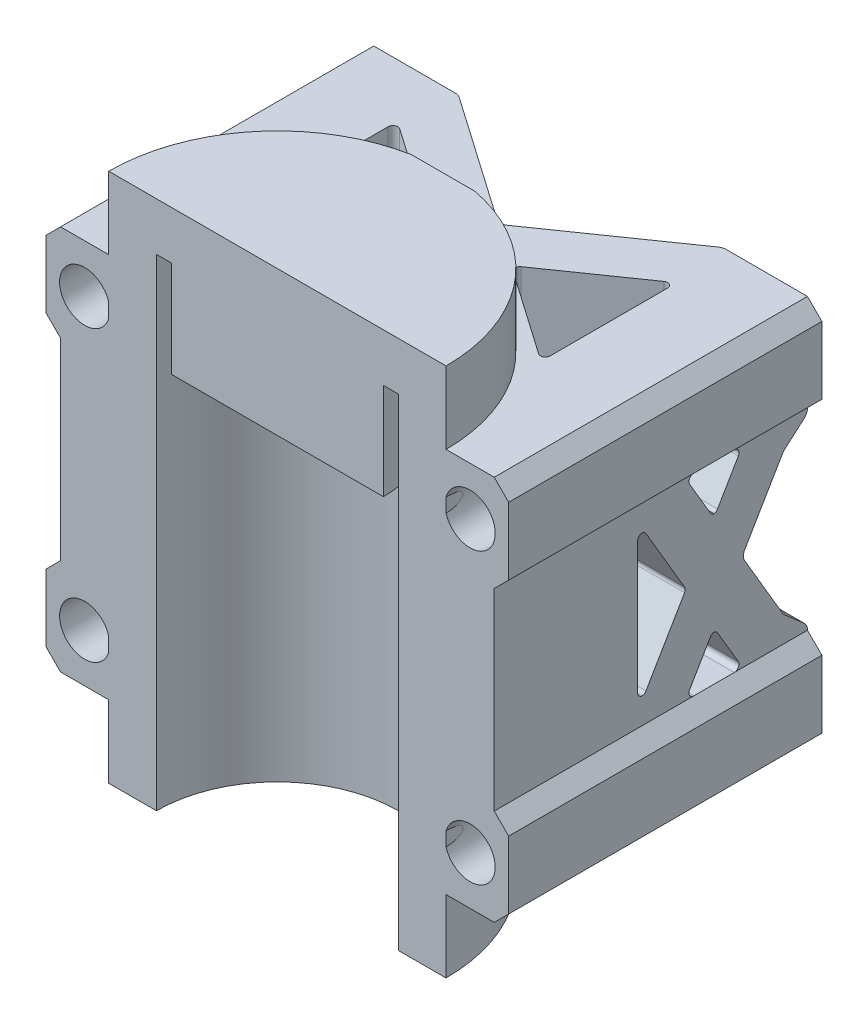
from build123d import *

# Parameters (mm, degrees)
BOSS_EXTRUDE1_DEPTH = 55
SKETCH4_R           = 2.6
BOSS_EXTRUDE2_DEPTH = 30
BOSS_EXTRUDE3_REACH = 55.686
SKETCH6_W           = 8
SKETCH6_H           = 30
BOSS_EXTRUDE4_REACH = 55.686
SKETCH7_W           = 8
SKETCH7_H           = 30
SKETCH8_W           = 20.202041029
SKETCH8_H           = 8
BOSS_EXTRUDE5_DEPTH = 29
SKETCH9_R           = 12.45
CUT_EXTRUDE1_DEPTH  = 100
CUT_EXTRUDE2_DEPTH  = 50
CUT_EXTRUDE15_DEPTH = 10
BOSS_EXTRUDE6_DEPTH = 2.5
CUT_EXTRUDE16_DEPTH = 80.01502149
CUT_EXTRUDE17_DEPTH = 63.357315313
FILLET1_R           = 1
FILLET4_R           = 0.5
SKETCH16_R          = 2.6
CUT_EXTRUDE18_DEPTH = 68.089006395
BOSS_EXTRUDE7_START = -5
BOSS_EXTRUDE7_DEPTH = 5
BOSS_EXTRUDE8_START = -15
BOSS_EXTRUDE8_DEPTH = 15
CUT_EXTRUDE21_START = 51
SKETCH18_R          = 12.55
SKETCH18_R_2        = 11
CUT_EXTRUDE21_DEPTH = 51


with BuildPart() as part:
    # Sketch1 → Boss-Extrude1 (new body)
    with BuildSketch(Plane(origin=(0, 0, 0), x_dir=(1, 0, 0), z_dir=(0, 1, 0))):
        with BuildLine():
            Line((-17.5, 0), (-12.55, 0))
            ThreePointArc((-12.55, 0), (-8.874190104, 8.874190104), (0, 12.55))
            ThreePointArc((0, 12.55), (8.874190104, 8.874190104), (12.55, 0))
            Line((12.55, 0), (17.5, 0))
            ThreePointArc((17.5, 0), (13.480591053, 11.1590172), (3.268724015, 17.192016848))
            Line((3.268724015, 17.192016848), (-0.344865062, 17.192016848))
            Line((-0.344865062, 17.192016848), (-3.268724015, 17.192016848))
            ThreePointArc((-3.268724015, 17.192016848), (-13.480591053, 11.1590172), (-17.5, 0))
        make_face()
    extrude(amount=BOSS_EXTRUDE1_DEPTH)

    # Sketch4 → Boss-Extrude2 (add)
    # profile 1 of 4: a face of its own
    with BuildSketch(Plane.XY):
        Polygon((-23.998641066, 16.001358934), (-22.5, 17.5), (-14.5, 17.5), (-14.5, 12.5), (-14.5, 7.5), (-22.5, 7.5), (-23.998641066, 8.998641066), align=None)
        with Locations((-19.998641066, 12.5)):
            Circle(SKETCH4_R, mode=Mode.SUBTRACT)
    # profile 2 of 4: a face of its own
    with BuildSketch(Plane.XY):
        Polygon((14.5, 7.5), (14.5, 12.5), (14.5, 17.5), (22.5, 17.5), (23.998641066, 16.001358934), (23.998641066, 8.998641066), (22.5, 7.5), align=None)
        with Locations((19.998641066, 12.5)):
            Circle(SKETCH4_R, mode=Mode.SUBTRACT)
    # profile 3 of 4: a face of its own
    with BuildSketch(Plane.XY):
        Polygon((14.5, 37.5), (14.5, 42.5), (14.5, 47.5), (22.5, 47.5), (23.998641066, 46.001358934), (23.998641066, 38.998641066), (22.5, 37.5), align=None)
        with Locations((19.998641066, 42.5)):
            Circle(SKETCH4_R, mode=Mode.SUBTRACT)
    # profile 4 of 4: a face of its own
    with BuildSketch(Plane.XY):
        Polygon((-22.5, 47.5), (-14.5, 47.5), (-14.5, 42.5), (-14.5, 37.5), (-22.5, 37.5), (-23.998641066, 38.998641066), (-23.998641066, 46.001358934), align=None)
        with Locations((-19.998641066, 42.5)):
            Circle(SKETCH4_R, mode=Mode.SUBTRACT)
    extrude(amount=-BOSS_EXTRUDE2_DEPTH)

    # Sketch6 → Boss-Extrude3 (add, up to next)
    with BuildSketch(Plane.XZ.offset(-37.5), mode=Mode.PRIVATE) as boss_extrude3_sk1:
        with Locations((-18.5, -15)):
            Rectangle(SKETCH6_W, SKETCH6_H)
    boss_extrude3_tool1 = extrude(boss_extrude3_sk1.sketch, amount=BOSS_EXTRUDE3_REACH, mode=Mode.PRIVATE) - part.part
    add(boss_extrude3_tool1.solids().sort_by_distance((-18.5, 37.5, -15))[0])

    # Sketch7 → Boss-Extrude4 (add, up to next)
    with BuildSketch(Plane.XZ.offset(-37.5), mode=Mode.PRIVATE) as boss_extrude4_sk1:
        with Locations((18.5, -15)):
            Rectangle(SKETCH7_W, SKETCH7_H)
    boss_extrude4_tool1 = extrude(boss_extrude4_sk1.sketch, amount=BOSS_EXTRUDE4_REACH, mode=Mode.PRIVATE) - part.part
    add(boss_extrude4_tool1.solids().sort_by_distance((18.5, 37.5, -15))[0])

    # Sketch8 → Boss-Extrude5 (add)
    with BuildSketch(Plane(origin=(-14.5, 0, 0), x_dir=(0, 0, -1), z_dir=(1, 0, 0))):
        with Locations((19.898979485, 11.5)):
            Rectangle(SKETCH8_W, SKETCH8_H)
        with Locations((19.898979485, 43.5)):
            Rectangle(SKETCH8_W, SKETCH8_H)
    extrude(amount=BOSS_EXTRUDE5_DEPTH)

    # Sketch9 → Cut-Extrude1 (cut)
    with BuildSketch(Plane.XZ.offset(-7.5)):
        Circle(SKETCH9_R)
    extrude(amount=-CUT_EXTRUDE1_DEPTH, mode=Mode.SUBTRACT)

    # Sketch10 → Cut-Extrude2 (cut, symmetric)
    with BuildSketch(Plane.XZ.offset(-39.5)):
        Polygon((14.5, -12.84476299), (4.37368266, -19.898979486), (14.5, -26.953195981), align=None)
        Polygon((10.12631734, -30), (0, -22.945783504), (-10.12631734, -30), align=None)
        Polygon((-14.5, -26.953195981), (-4.37368266, -19.898979486), (-14.5, -12.84476299), align=None)
    extrude(amount=CUT_EXTRUDE2_DEPTH, both=True, mode=Mode.SUBTRACT)

    # Sketch11 → Cut-Extrude15 (cut)
    with BuildSketch(Plane(origin=(-14.5, 0, 0), x_dir=(0, 0, -1), z_dir=(1, 0, 0))):
        Polygon((29.02361167, 33.15567867), (25.698913189, 27.5), (29.02361167, 21.84432133), (30, 20.184821184), (30, 22.184821184), (30, 32.816622868), (30, 34.816622868), (29.821873982, 34.513610872), align=None)
        Polygon((22.573529128, 32.816622868), (23.024363547, 32.816622868), (24.200066296, 34.816622868), (21.397826379, 34.816622868), align=None)
        Polygon((21.397826379, 34.816622868), (24.200066296, 34.816622868), (25.777493232, 37.5), (22.281875838, 37.5), (19.820399443, 37.5), align=None)
        Polygon((15.598741563, 20.184821184), (19.898979486, 27.5), (15.597892675, 34.816622868), (14.875672645, 34.816622868), (14.875672645, 20.184821184), align=None)
        Polygon((22.574378016, 22.184821184), (21.398675266, 20.184821184), (24.199217408, 20.184821184), (23.023514659, 22.184821184), align=None)
        Polygon((24.199217408, 20.184821184), (21.398675266, 20.184821184), (19.820399443, 17.5), (22.402804222, 17.5), (25.777493232, 17.5), align=None)
    cut_extrude15 = extrude(amount=-CUT_EXTRUDE15_DEPTH, mode=Mode.SUBTRACT)

    # Mirror1: Cut-Extrude15 across plane
    add(cut_extrude15.mirror(Plane(origin=(0, 0, 0), x_dir=(0, 0, 1), z_dir=(1, 0, 0))), mode=Mode.SUBTRACT)

    # Sketch12 → Boss-Extrude6 (add)
    with BuildSketch(Plane(origin=(0, 0, -30), x_dir=(-1, 0, 0), z_dir=(0, 0, -1))):
        Polygon((10.12631734, 15.5), (14.5, 15.5), (14.5, 20.184821184), (22.5, 20.184821184), (22.5, 17.5), (23.998641066, 16.001358934), (23.998641066, 8.998641066), (22.5, 7.5), (10.12631734, 7.5), align=None)
        Polygon((-22.5, 17.5), (-22.5, 20.184821184), (-14.5, 20.184821184), (-14.5, 15.5), (-10.12631734, 15.5), (-10.12631734, 7.5), (-22.5, 7.5), (-23.998641066, 8.998641066), (-23.998641066, 16.001358934), align=None)
        Polygon((-22.5, 37.5), (-23.998641066, 38.998641066), (-23.998641066, 46.001358934), (-22.5, 47.5), (-10.12631734, 47.5), (-10.12631734, 39.5), (-14.5, 39.5), (-14.5, 34.816622868), (-22.5, 34.816622868), align=None)
        Polygon((10.12631734, 47.5), (10.12631734, 39.5), (14.5, 39.5), (14.5, 34.816622868), (22.5, 34.816622868), (22.5, 37.5), (23.998641066, 38.998641066), (23.998641066, 46.001358934), (22.5, 47.5), align=None)
    extrude(amount=BOSS_EXTRUDE6_DEPTH)

    # Sketch13 → Cut-Extrude16 (cut, through all)
    with BuildSketch(Plane.ZY.offset(22.5)):
        Polygon((-32.5, 20.184821184), (-32.5, 18), (-30, 20.184821184), align=None)
        Polygon((-30, 34.816622868), (-32.5, 37), (-32.5, 34.816622868), align=None)
    extrude(amount=-CUT_EXTRUDE16_DEPTH, mode=Mode.SUBTRACT)

    # Sketch14 → Cut-Extrude17 (cut, through all)
    with BuildSketch(Plane(origin=(0, 47.5, 0), x_dir=(1, 0, 0), z_dir=(0, 1, 0))):
        Polygon((-10.12631734, 30), (-13.715063641, 32.5), (-10.12631734, 32.5), align=None)
        Polygon((10.12631734, 30), (13.715063641, 32.5), (10.12631734, 32.5), align=None)
    extrude(amount=-CUT_EXTRUDE17_DEPTH, mode=Mode.SUBTRACT)

    # Fillet1
    fillet1_edges = [part.edges().sort_by_distance(p)[0] for p in [
        (0, 43.5, -22.945783504),
        (0, 11.5, -22.945783504),
        (-18.5, 27.5, -25.698913189),
        (-18.5, 34.816622868, -30),
        (-18.5, 20.184821184, -30),
        (18.5, 27.5, -25.698913189),
        (18.5, 20.184821184, -30),
        (18.5, 34.816622868, -30),
        (18.5, 18, -32.5),
        (-18.5, 18, -32.5),
        (18.5, 37, -32.5),
        (-18.5, 37, -32.5),
        (-13.715063641, 11.5, -32.5),
        (-13.715063641, 43.5, -32.5),
        (13.715063641, 11.5, -32.5),
        (13.715063641, 43.5, -32.5),
    ]]
    fillet(fillet1_edges, radius=FILLET1_R)

    # Fillet4
    # the kernel refuses this fillet: 0.5 mm, written as the material it adds along each edge
    with BuildSketch(Plane(origin=(-14.5, 39.5, -12.84476299), x_dir=(0, 0, -1), z_dir=(0, 1, 0)), Plane(origin=(-14.5, 7.5, -26.953195981), x_dir=(0.8205319360133092, 2.8568127323077983e-15, 0.5716006840288512), z_dir=(0, 1, 0)), Plane(origin=(14.5, 47.5, -12.84476299), x_dir=(0, 0, -1), z_dir=(0, -1, 0)), Plane(origin=(14.5, 15.5, -12.84476299), x_dir=(0, 0, -1), z_dir=(0, -1, 0)), Plane(origin=(14.5, 39.5, -26.953195981), x_dir=(0, 0, 1), z_dir=(0, 1, 0)), Plane(origin=(14.5, 7.5, -26.953195981), x_dir=(0, 0, 1), z_dir=(0, 1, 0))) as fillet4_piece_1:
        with BuildLine():
            CenterArc((FILLET4_R * 1.91534371187, -FILLET4_R), FILLET4_R, 90, 124.861921912)
            Line((FILLET4_R * 1.09481177585, -FILLET4_R * 1.57160068403), (0, 0))
            Line((0, 0), (FILLET4_R * 1.91534371187, 0))
        make_face()
    extrude(amount=8)
    with BuildSketch(Plane(origin=(-14.5, 7.5, -12.84476299), x_dir=(0.8205319360133058, 2.856812732307786e-15, -0.5716006840288562), z_dir=(0, 1, 0)), Plane(origin=(-14.5, 39.5, -26.953195981), x_dir=(0, 0, 1), z_dir=(0, 1, 0))) as fillet4_piece_2:
        with BuildLine():
            CenterArc((FILLET4_R * 1.91534371187, FILLET4_R), FILLET4_R, 145.138078088, 124.861921912)
            Line((FILLET4_R * 1.09481177585, FILLET4_R * 1.57160068403), (0, 0))
            Line((0, 0), (FILLET4_R * 1.91534371187, 0))
        make_face()
    extrude(amount=8)
    with BuildSketch(Plane(origin=(-4.37368266, 47.5, -19.898979486), x_dir=(-0.8205319360133027, -2.849524944725357e-15, 0.5716006840288604), z_dir=(0, -1, 0)), Plane(origin=(4.37368266, 7.5, -19.898979486), x_dir=(0.8205319360133051, 2.849524944725366e-15, 0.5716006840288572), z_dir=(0, 1, 0))) as fillet4_piece_3:
        with BuildLine():
            CenterArc((FILLET4_R * 1.4354985201, FILLET4_R), FILLET4_R, 159.723843824, 110.276156176)
            Line((FILLET4_R * 0.497465288318, FILLET4_R * 1.34654531604), (0, 0))
            Line((0, 0), (FILLET4_R * 1.4354985201, 0))
        make_face()
    extrude(amount=8)
    with BuildSketch(Plane(origin=(-4.37368266, 15.5, -19.898979486), x_dir=(-0.8205319360133059, -2.8495249447253684e-15, -0.571600684028856), z_dir=(0, -1, 0)), Plane(origin=(4.37368266, 39.5, -19.898979486), x_dir=(0.8205319360132926, 2.8495249447253227e-15, -0.5716006840288751), z_dir=(0, 1, 0))) as fillet4_piece_4:
        with BuildLine():
            CenterArc((FILLET4_R * 1.4354985201, -FILLET4_R), FILLET4_R, 90, 110.276156176)
            Line((FILLET4_R * 0.497465288318, -FILLET4_R * 1.34654531604), (0, 0))
            Line((0, 0), (FILLET4_R * 1.4354985201, 0))
        make_face()
    extrude(amount=8)
    with BuildSketch(Plane(origin=(-14.5, 34.816622868, -15.597892675), x_dir=(0, 0, 1), z_dir=(-1, 0, 0)), Plane(origin=(14.5, 34.816622868, -15.597892675), x_dir=(-2.9909367323885665e-15, -0.8620788194223284, -0.5067742190595379), z_dir=(1, 0, 0)), Plane(origin=(14.5, 32.816622868, -23.024363547), x_dir=(0, 0, 1), z_dir=(1, 0, 0)), Plane(origin=(14.5, 22.184821184, -22.574378016), x_dir=(0, 0, -1), z_dir=(1, 0, 0))) as fillet4_piece_5:
        with BuildLine():
            CenterArc((FILLET4_R * 0.572135366081, -FILLET4_R), FILLET4_R, 90, 59.550800041)
            Line((-FILLET4_R * 0.289943453342, -FILLET4_R * 0.49322578094), (0, 0))
            Line((0, 0), (FILLET4_R * 0.572135366081, 0))
        make_face()
    extrude(amount=8)
    with BuildSketch(Plane(origin=(-14.5, 27.5, -19.898979486), x_dir=(2.990936732388565e-15, -0.862078819422328, 0.5067742190595386), z_dir=(-1, 0, 0))) as fillet4_piece_6:
        with BuildLine():
            CenterArc((FILLET4_R * 0.587851374656, FILLET4_R), FILLET4_R, 209.101600081, 60.898399919)
            Line((-FILLET4_R * 0.285907266305, FILLET4_R * 0.513640218207), (0, 0))
            Line((0, 0), (FILLET4_R * 0.587851374656, 0))
        make_face()
    extrude(amount=8)
    with BuildSketch(Plane(origin=(-14.5, 20.184821184, -15.598741563), x_dir=(0, 0, 1), z_dir=(-1, 0, 0)), Plane(origin=(-14.5, 32.816622868, -23.024363547), x_dir=(0, 0, 1), z_dir=(-1, 0, 0)), Plane(origin=(-14.5, 32.816622868, -22.573529128), x_dir=(-2.990936732388557e-15, 0.8620788194223257, 0.5067742190595426), z_dir=(-1, 0, 0)), Plane(origin=(-14.5, 22.184821184, -23.023514659), x_dir=(2.990936732388576e-15, -0.8620788194223311, -0.5067742190595332), z_dir=(-1, 0, 0)), Plane(origin=(-14.5, 22.184821184, -22.574378016), x_dir=(0, 0, -1), z_dir=(-1, 0, 0)), Plane(origin=(14.5, 20.184821184, -15.598741563), x_dir=(2.990936732388546e-15, 0.8620788194223225, -0.5067742190595479), z_dir=(1, 0, 0)), Plane(origin=(14.5, 32.816622868, -22.573529128), x_dir=(0, 0, -1), z_dir=(1, 0, 0)), Plane(origin=(14.5, 22.184821184, -23.023514659), x_dir=(0, 0, 1), z_dir=(1, 0, 0))) as fillet4_piece_7:
        with BuildLine():
            CenterArc((FILLET4_R * 0.572135366081, FILLET4_R), FILLET4_R, 210.449199959, 59.550800041)
            Line((-FILLET4_R * 0.289943453342, FILLET4_R * 0.49322578094), (0, 0))
            Line((0, 0), (FILLET4_R * 0.572135366081, 0))
        make_face()
    extrude(amount=8)
    with BuildSketch(Plane(origin=(-14.5, 20.184821184, -14.875672645), x_dir=(0, 0, -1), z_dir=(-1, 0, 0)), Plane(origin=(-14.5, 34.816622868, -14.875672645), x_dir=(0, -1, 0), z_dir=(-1, 0, 0))) as fillet4_piece_8:
        with BuildLine():
            CenterArc((FILLET4_R, -FILLET4_R), FILLET4_R, 90, 90)
            Line((0, -FILLET4_R), (0, 0))
            Line((0, 0), (FILLET4_R, 0))
        make_face()
    extrude(amount=8)
    with BuildSketch(Plane(origin=(-14.5, 37.5, -19.820399443), x_dir=(2.9909367323885563e-15, -0.8620788194223254, -0.5067742190595429), z_dir=(-1, 0, 0))) as fillet4_piece_9_section:
        with BuildLine():
            CenterArc((FILLET4_R * 1.74783811539, -FILLET4_R), FILLET4_R, 90, 120.449199959)
            Line((FILLET4_R * 0.885759295971, -FILLET4_R * 1.50677421906), (0, 0))
            Line((0, 0), (FILLET4_R * 1.74783811539, 0))
        make_face()
    fillet4_piece_9 = extrude(amount=8, mode=Mode.PRIVATE)
    fillet4_piece_9 = split(fillet4_piece_9, bisect_by=Plane(origin=(-20.363529136, 35.363529136, -20.144307431), z_dir=(0.7071067811865483, 0.7071067811865467, 0)), keep=Keep.TOP, mode=Mode.PRIVATE)
    add(fillet4_piece_9)
    with BuildSketch(Plane(origin=(-14.5, 37.5, -19.820399443), x_dir=(2.9909367323885563e-15, -0.8620788194223254, -0.5067742190595429), z_dir=(-1, 0, 0))) as fillet4_piece_10_section:
        with BuildLine():
            CenterArc((FILLET4_R * 1.74783811539, -FILLET4_R), FILLET4_R, 90, 120.449199959)
            Line((FILLET4_R * 0.885759295971, -FILLET4_R * 1.50677421906), (0, 0))
            Line((0, 0), (FILLET4_R * 1.74783811539, 0))
        make_face()
    fillet4_piece_10 = extrude(amount=8, mode=Mode.PRIVATE)
    fillet4_piece_10 = split(fillet4_piece_10, bisect_by=Plane(origin=(-22.257808065, 37.257808065, -20.13165213), z_dir=(-0.7071067811865483, -0.7071067811865467, 0)), keep=Keep.TOP, mode=Mode.PRIVATE)
    add(fillet4_piece_10)
    with BuildSketch(Plane(origin=(-14.5, 37.5, -25.777493232), x_dir=(0, 0, 1), z_dir=(-1, 0, 0))) as fillet4_piece_11_section:
        with BuildLine():
            CenterArc((FILLET4_R * 1.74783811539, -FILLET4_R), FILLET4_R, 90, 120.449199959)
            Line((FILLET4_R * 0.885759295971, -FILLET4_R * 1.50677421906), (0, 0))
            Line((0, 0), (FILLET4_R * 1.74783811539, 0))
        make_face()
    fillet4_piece_11 = extrude(amount=8, mode=Mode.PRIVATE)
    fillet4_piece_11 = split(fillet4_piece_11, bisect_by=Plane(origin=(-20.363529136, 35.363529136, -25.453585244), z_dir=(0.7071067811865483, 0.7071067811865467, 0)), keep=Keep.TOP, mode=Mode.PRIVATE)
    add(fillet4_piece_11)
    with BuildSketch(Plane(origin=(-14.5, 37.5, -25.777493232), x_dir=(0, 0, 1), z_dir=(-1, 0, 0))) as fillet4_piece_12_section:
        with BuildLine():
            CenterArc((FILLET4_R * 1.74783811539, -FILLET4_R), FILLET4_R, 90, 120.449199959)
            Line((FILLET4_R * 0.885759295971, -FILLET4_R * 1.50677421906), (0, 0))
            Line((0, 0), (FILLET4_R * 1.74783811539, 0))
        make_face()
    fillet4_piece_12 = extrude(amount=8, mode=Mode.PRIVATE)
    fillet4_piece_12 = split(fillet4_piece_12, bisect_by=Plane(origin=(-22.257808065, 37.257808065, -25.466240545), z_dir=(-0.7071067811865483, -0.7071067811865467, 0)), keep=Keep.TOP, mode=Mode.PRIVATE)
    add(fillet4_piece_12)
    with BuildSketch(Plane(origin=(-14.5, 17.5, -25.777493232), x_dir=(-2.990936732388562e-15, 0.8620788194223271, 0.5067742190595398), z_dir=(-1, 0, 0))) as fillet4_piece_13_section:
        with BuildLine():
            CenterArc((FILLET4_R * 1.74783811539, -FILLET4_R), FILLET4_R, 90, 120.449199959)
            Line((FILLET4_R * 0.885759295971, -FILLET4_R * 1.50677421906), (0, 0))
            Line((0, 0), (FILLET4_R * 1.74783811539, 0))
        make_face()
    fillet4_piece_13 = extrude(amount=8, mode=Mode.PRIVATE)
    fillet4_piece_13 = split(fillet4_piece_13, bisect_by=Plane(origin=(-20.363529136, 19.636470864, -25.453585244), z_dir=(0.7071067811865451, -0.7071067811865501, 0)), keep=Keep.TOP, mode=Mode.PRIVATE)
    add(fillet4_piece_13)
    with BuildSketch(Plane(origin=(-14.5, 17.5, -25.777493232), x_dir=(-2.990936732388562e-15, 0.8620788194223271, 0.5067742190595398), z_dir=(-1, 0, 0))) as fillet4_piece_14_section:
        with BuildLine():
            CenterArc((FILLET4_R * 1.74783811539, -FILLET4_R), FILLET4_R, 90, 120.449199959)
            Line((FILLET4_R * 0.885759295971, -FILLET4_R * 1.50677421906), (0, 0))
            Line((0, 0), (FILLET4_R * 1.74783811539, 0))
        make_face()
    fillet4_piece_14 = extrude(amount=8, mode=Mode.PRIVATE)
    fillet4_piece_14 = split(fillet4_piece_14, bisect_by=Plane(origin=(-22.257808065, 17.742191935, -25.466240545), z_dir=(-0.7071067811865451, 0.7071067811865501, 0)), keep=Keep.TOP, mode=Mode.PRIVATE)
    add(fillet4_piece_14)
    with BuildSketch(Plane(origin=(-14.5, 17.5, -19.820399443), x_dir=(0, 0, -1), z_dir=(-1, 0, 0))) as fillet4_piece_15_section:
        with BuildLine():
            CenterArc((FILLET4_R * 1.74783811539, -FILLET4_R), FILLET4_R, 90, 120.449199959)
            Line((FILLET4_R * 0.885759295971, -FILLET4_R * 1.50677421906), (0, 0))
            Line((0, 0), (FILLET4_R * 1.74783811539, 0))
        make_face()
    fillet4_piece_15 = extrude(amount=8, mode=Mode.PRIVATE)
    fillet4_piece_15 = split(fillet4_piece_15, bisect_by=Plane(origin=(-20.363529136, 19.636470864, -20.144307431), z_dir=(0.7071067811865451, -0.7071067811865501, 0)), keep=Keep.TOP, mode=Mode.PRIVATE)
    add(fillet4_piece_15)
    with BuildSketch(Plane(origin=(-14.5, 17.5, -19.820399443), x_dir=(0, 0, -1), z_dir=(-1, 0, 0))) as fillet4_piece_16_section:
        with BuildLine():
            CenterArc((FILLET4_R * 1.74783811539, -FILLET4_R), FILLET4_R, 90, 120.449199959)
            Line((FILLET4_R * 0.885759295971, -FILLET4_R * 1.50677421906), (0, 0))
            Line((0, 0), (FILLET4_R * 1.74783811539, 0))
        make_face()
    fillet4_piece_16 = extrude(amount=8, mode=Mode.PRIVATE)
    fillet4_piece_16 = split(fillet4_piece_16, bisect_by=Plane(origin=(-22.257808065, 17.742191935, -20.13165213), z_dir=(-0.7071067811865451, 0.7071067811865501, 0)), keep=Keep.TOP, mode=Mode.PRIVATE)
    add(fillet4_piece_16)
    with BuildSketch(Plane(origin=(14.5, 27.5, -19.898979486), x_dir=(-2.990936732388565e-15, -0.862078819422328, 0.5067742190595386), z_dir=(1, 0, 0))) as fillet4_piece_17:
        with BuildLine():
            CenterArc((FILLET4_R * 0.587851374656, -FILLET4_R), FILLET4_R, 90, 60.898399919)
            Line((-FILLET4_R * 0.285907266305, -FILLET4_R * 0.513640218207), (0, 0))
            Line((0, 0), (FILLET4_R * 0.587851374656, 0))
        make_face()
    extrude(amount=8)
    with BuildSketch(Plane(origin=(14.5, 34.816622868, -14.875672645), x_dir=(0, -1, 0), z_dir=(1, 0, 0)), Plane(origin=(14.5, 20.184821184, -14.875672645), x_dir=(0, 0, -1), z_dir=(1, 0, 0))) as fillet4_piece_18:
        with BuildLine():
            CenterArc((FILLET4_R, FILLET4_R), FILLET4_R, 180, 90)
            Line((0, FILLET4_R), (0, 0))
            Line((0, 0), (FILLET4_R, 0))
        make_face()
    extrude(amount=8)
    with BuildSketch(Plane(origin=(14.5, 37.5, -25.777493232), x_dir=(-2.990936732388562e-15, -0.8620788194223271, 0.5067742190595398), z_dir=(1, 0, 0))) as fillet4_piece_19_section:
        with BuildLine():
            CenterArc((FILLET4_R * 1.74783811539, -FILLET4_R), FILLET4_R, 90, 120.449199959)
            Line((FILLET4_R * 0.885759295971, -FILLET4_R * 1.50677421906), (0, 0))
            Line((0, 0), (FILLET4_R * 1.74783811539, 0))
        make_face()
    fillet4_piece_19 = extrude(amount=8, mode=Mode.PRIVATE)
    fillet4_piece_19 = split(fillet4_piece_19, bisect_by=Plane(origin=(20.363529136, 35.363529136, -25.453585244), z_dir=(-0.7071067811865483, 0.7071067811865467, 0)), keep=Keep.TOP, mode=Mode.PRIVATE)
    add(fillet4_piece_19)
    with BuildSketch(Plane(origin=(14.5, 37.5, -25.777493232), x_dir=(-2.990936732388562e-15, -0.8620788194223271, 0.5067742190595398), z_dir=(1, 0, 0))) as fillet4_piece_20_section:
        with BuildLine():
            CenterArc((FILLET4_R * 1.74783811539, -FILLET4_R), FILLET4_R, 90, 120.449199959)
            Line((FILLET4_R * 0.885759295971, -FILLET4_R * 1.50677421906), (0, 0))
            Line((0, 0), (FILLET4_R * 1.74783811539, 0))
        make_face()
    fillet4_piece_20 = extrude(amount=8, mode=Mode.PRIVATE)
    fillet4_piece_20 = split(fillet4_piece_20, bisect_by=Plane(origin=(22.257808065, 37.257808065, -25.466240545), z_dir=(0.7071067811865483, -0.7071067811865467, 0)), keep=Keep.TOP, mode=Mode.PRIVATE)
    add(fillet4_piece_20)
    with BuildSketch(Plane(origin=(14.5, 37.5, -19.820399443), x_dir=(-2.9909367323885563e-15, -0.8620788194223254, -0.5067742190595429), z_dir=(1, 0, 0))) as fillet4_piece_21_section:
        with BuildLine():
            CenterArc((FILLET4_R * 1.74783811539, FILLET4_R), FILLET4_R, 149.550800041, 120.449199959)
            Line((FILLET4_R * 0.885759295971, FILLET4_R * 1.50677421906), (0, 0))
            Line((0, 0), (FILLET4_R * 1.74783811539, 0))
        make_face()
    fillet4_piece_21 = extrude(amount=8, mode=Mode.PRIVATE)
    fillet4_piece_21 = split(fillet4_piece_21, bisect_by=Plane(origin=(20.363529136, 35.363529136, -20.144307431), z_dir=(-0.7071067811865483, 0.7071067811865467, 0)), keep=Keep.TOP, mode=Mode.PRIVATE)
    add(fillet4_piece_21)
    with BuildSketch(Plane(origin=(14.5, 37.5, -19.820399443), x_dir=(-2.9909367323885563e-15, -0.8620788194223254, -0.5067742190595429), z_dir=(1, 0, 0))) as fillet4_piece_22_section:
        with BuildLine():
            CenterArc((FILLET4_R * 1.74783811539, FILLET4_R), FILLET4_R, 149.550800041, 120.449199959)
            Line((FILLET4_R * 0.885759295971, FILLET4_R * 1.50677421906), (0, 0))
            Line((0, 0), (FILLET4_R * 1.74783811539, 0))
        make_face()
    fillet4_piece_22 = extrude(amount=8, mode=Mode.PRIVATE)
    fillet4_piece_22 = split(fillet4_piece_22, bisect_by=Plane(origin=(22.257808065, 37.257808065, -20.13165213), z_dir=(0.7071067811865483, -0.7071067811865467, 0)), keep=Keep.TOP, mode=Mode.PRIVATE)
    add(fillet4_piece_22)
    with BuildSketch(Plane(origin=(14.5, 17.5, -25.777493232), x_dir=(2.990936732388562e-15, 0.8620788194223271, 0.5067742190595398), z_dir=(1, 0, 0))) as fillet4_piece_23_section:
        with BuildLine():
            CenterArc((FILLET4_R * 1.74783811539, FILLET4_R), FILLET4_R, 149.550800041, 120.449199959)
            Line((FILLET4_R * 0.885759295971, FILLET4_R * 1.50677421906), (0, 0))
            Line((0, 0), (FILLET4_R * 1.74783811539, 0))
        make_face()
    fillet4_piece_23 = extrude(amount=8, mode=Mode.PRIVATE)
    fillet4_piece_23 = split(fillet4_piece_23, bisect_by=Plane(origin=(20.363529136, 19.636470864, -25.453585244), z_dir=(-0.7071067811865451, -0.7071067811865501, 0)), keep=Keep.TOP, mode=Mode.PRIVATE)
    add(fillet4_piece_23)
    with BuildSketch(Plane(origin=(14.5, 17.5, -25.777493232), x_dir=(2.990936732388562e-15, 0.8620788194223271, 0.5067742190595398), z_dir=(1, 0, 0))) as fillet4_piece_24_section:
        with BuildLine():
            CenterArc((FILLET4_R * 1.74783811539, FILLET4_R), FILLET4_R, 149.550800041, 120.449199959)
            Line((FILLET4_R * 0.885759295971, FILLET4_R * 1.50677421906), (0, 0))
            Line((0, 0), (FILLET4_R * 1.74783811539, 0))
        make_face()
    fillet4_piece_24 = extrude(amount=8, mode=Mode.PRIVATE)
    fillet4_piece_24 = split(fillet4_piece_24, bisect_by=Plane(origin=(22.257808065, 17.742191935, -25.466240545), z_dir=(0.7071067811865451, 0.7071067811865501, 0)), keep=Keep.TOP, mode=Mode.PRIVATE)
    add(fillet4_piece_24)
    with BuildSketch(Plane(origin=(14.5, 17.5, -19.820399443), x_dir=(2.9909367323885657e-15, 0.8620788194223282, -0.5067742190595381), z_dir=(1, 0, 0))) as fillet4_piece_25_section:
        with BuildLine():
            CenterArc((FILLET4_R * 1.74783811539, -FILLET4_R), FILLET4_R, 90, 120.449199959)
            Line((FILLET4_R * 0.885759295971, -FILLET4_R * 1.50677421906), (0, 0))
            Line((0, 0), (FILLET4_R * 1.74783811539, 0))
        make_face()
    fillet4_piece_25 = extrude(amount=8, mode=Mode.PRIVATE)
    fillet4_piece_25 = split(fillet4_piece_25, bisect_by=Plane(origin=(20.363529136, 19.636470864, -20.144307431), z_dir=(-0.7071067811865451, -0.7071067811865501, 0)), keep=Keep.TOP, mode=Mode.PRIVATE)
    add(fillet4_piece_25)
    with BuildSketch(Plane(origin=(14.5, 17.5, -19.820399443), x_dir=(2.9909367323885657e-15, 0.8620788194223282, -0.5067742190595381), z_dir=(1, 0, 0))) as fillet4_piece_26_section:
        with BuildLine():
            CenterArc((FILLET4_R * 1.74783811539, -FILLET4_R), FILLET4_R, 90, 120.449199959)
            Line((FILLET4_R * 0.885759295971, -FILLET4_R * 1.50677421906), (0, 0))
            Line((0, 0), (FILLET4_R * 1.74783811539, 0))
        make_face()
    fillet4_piece_26 = extrude(amount=8, mode=Mode.PRIVATE)
    fillet4_piece_26 = split(fillet4_piece_26, bisect_by=Plane(origin=(22.257808065, 17.742191935, -20.13165213), z_dir=(0.7071067811865451, 0.7071067811865501, 0)), keep=Keep.TOP, mode=Mode.PRIVATE)
    add(fillet4_piece_26)

    # Sketch16 → Cut-Extrude18 (cut, through all)
    with BuildSketch(Plane.XY.offset(-30)):
        with Locations((-19.998641066, 42.5)):
            Circle(SKETCH16_R)
        with Locations((19.998641066, 42.5)):
            Circle(SKETCH16_R)
        with Locations((-19.998641066, 12.5)):
            Circle(SKETCH16_R)
        with Locations((19.998641066, 12.5)):
            Circle(SKETCH16_R)
    extrude(amount=-CUT_EXTRUDE18_DEPTH, mode=Mode.SUBTRACT)

    # Sketch17 → Boss-Extrude7 (add)
    with BuildSketch(Plane(origin=(0, 55, 0), x_dir=(1, 0, 0), z_dir=(0, 1, 0)).offset(BOSS_EXTRUDE7_START)):
        with BuildLine():
            Line((11, 0), (12.55, 0))
            ThreePointArc((12.55, 0), (0, 12.55), (-12.55, 0))
            Line((-12.55, 0), (-11, 0))
            ThreePointArc((-11, 0), (0, 11), (11, 0))
        make_face()
    extrude(amount=BOSS_EXTRUDE7_DEPTH)

    # Sketch17<3> → Boss-Extrude8 (add)
    with BuildSketch(Plane(origin=(0, 55, 0), x_dir=(1, 0, 0), z_dir=(0, 1, 0)).offset(BOSS_EXTRUDE8_START)):
        with BuildLine():
            Line((0, 0), (11, 0))
            ThreePointArc((11, 0), (7.778174593, 7.778174593), (0, 11))
            Line((0, 11), (0, 0))
        make_face()
        with BuildLine():
            ThreePointArc((0, 11), (-7.778174593, 7.778174593), (-11, 0))
            Line((-11, 0), (0, 0))
            Line((0, 0), (0, 11))
        make_face()
    extrude(amount=BOSS_EXTRUDE8_DEPTH)

    # Sketch18 → Cut-Extrude21 (cut)
    with BuildSketch(Plane.XZ.offset(-50).offset(CUT_EXTRUDE21_START)):
        Circle(SKETCH18_R)
        Circle(SKETCH18_R_2, mode=Mode.SUBTRACT)
    extrude(amount=-CUT_EXTRUDE21_DEPTH, mode=Mode.SUBTRACT)


solid = part.part
